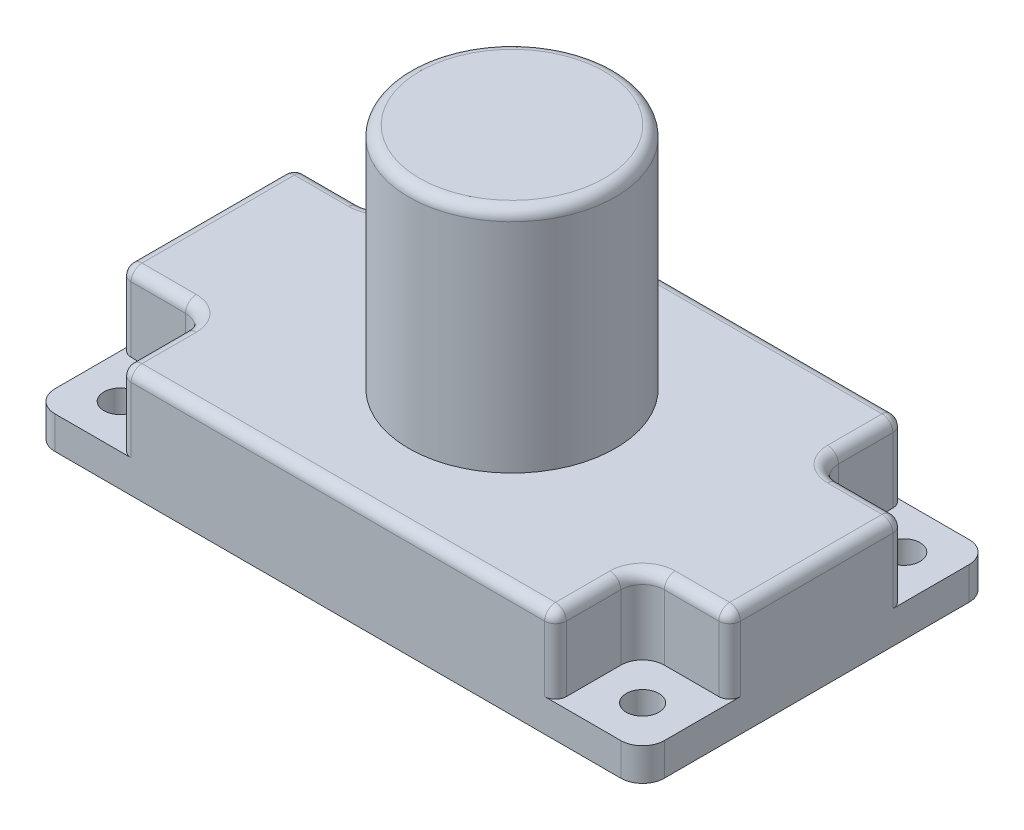
from build123d import *

# Parameters (mm, degrees)
CROQUIS1_W              = 56
CROQUIS1_H              = 32
SALIENTE_EXTRUIR1_DEPTH = 10
CROQUIS2_R              = 9.5
SALIENTE_EXTRUIR2_DEPTH = 21
CROQUIS3_W              = 8
CROQUIS3_H              = 8
CORTAR_EXTRUIR1_DEPTH   = 7
CROQUIS4_R              = 1.5
CORTAR_EXTRUIR2_DEPTH   = 71.313583325
REDONDEO1_R             = 2
REDONDEO2_R             = 1
REDONDEO3_R             = 1
REDONDEO4_R             = 1


with BuildPart() as part:
    # Croquis1 → Saliente-Extruir1 (new body)
    with BuildSketch(Plane(origin=(0, 0, 0), x_dir=(1, 0, 0), z_dir=(0, 1, 0))):
        with Locations((28, -16)):
            Rectangle(CROQUIS1_W, CROQUIS1_H)
    extrude(amount=SALIENTE_EXTRUIR1_DEPTH)

    # Croquis2 → Saliente-Extruir2 (add)
    with BuildSketch(Plane(origin=(0, 10, 0), x_dir=(1, 0, 0), z_dir=(0, 1, 0))):
        with Locations((28, -16)):
            Circle(CROQUIS2_R)
    extrude(amount=SALIENTE_EXTRUIR2_DEPTH)

    # Croquis3 → Cortar-Extruir1 (cut)
    with BuildSketch(Plane(origin=(0, 10, 0), x_dir=(1, 0, 0), z_dir=(0, 1, 0))):
        with Locations((52, -28)):
            Rectangle(CROQUIS3_W, CROQUIS3_H)
        with Locations((52, -4)):
            Rectangle(CROQUIS3_W, CROQUIS3_H)
        with Locations((4, -4)):
            Rectangle(CROQUIS3_W, CROQUIS3_H)
        with Locations((4, -28)):
            Rectangle(CROQUIS3_W, CROQUIS3_H)
    extrude(amount=-CORTAR_EXTRUIR1_DEPTH, mode=Mode.SUBTRACT)

    # Croquis4 → Cortar-Extruir2 (cut, through all)
    with BuildSketch(Plane(origin=(0, 3, 0), x_dir=(1, 0, 0), z_dir=(0, 1, 0))):
        with Locations((4, -4)):
            Circle(CROQUIS4_R)
        with Locations((4, -28)):
            Circle(CROQUIS4_R)
        with Locations((52, -28)):
            Circle(CROQUIS4_R)
        with Locations((52, -4)):
            Circle(CROQUIS4_R)
    extrude(amount=-CORTAR_EXTRUIR2_DEPTH, mode=Mode.SUBTRACT)

    # Redondeo1
    redondeo1_edges = [part.edges().sort_by_distance(p)[0] for p in [
        (48, 6.5, 8),
        (56, 1.5, 0),
        (56, 1.5, 32),
        (48, 6.5, 24),
        (8, 6.5, 8),
        (0, 1.5, 0),
        (0, 1.5, 32),
        (8, 6.5, 24),
    ]]
    fillet(redondeo1_edges, radius=REDONDEO1_R)

    # Redondeo2
    redondeo2_edges = [part.edges().sort_by_distance(p)[0] for p in [
        (0, 10, 16),
        (28, 10, 0),
        (56, 10, 16),
        (28, 10, 32),
    ]]
    fillet(redondeo2_edges, radius=REDONDEO2_R)

    # Redondeo3
    redondeo3_edges = [part.edges().sort_by_distance(p)[0] for p in [
        (8, 6, 0),
        (8, 9.707106781, 0.292893219),
        (8, 10, 3.5),
        (0, 6, 8),
        (0.292893219, 9.707106781, 8),
        (3.5, 10, 8),
        (48, 6, 0),
        (56, 6, 8),
        (55.707106781, 9.707106781, 8),
        (52.5, 10, 8),
        (48.585786438, 10, 7.414213562),
        (48, 10, 3.5),
        (56, 6, 24),
        (55.707106781, 9.707106781, 24),
        (52.5, 10, 24),
        (48.585786438, 10, 24.585786438),
        (48, 10, 28.5),
        (48, 6, 32),
        (8, 6, 32),
        (8, 9.707106781, 31.707106781),
        (8, 10, 28.5),
        (7.414213562, 10, 24.585786438),
        (3.5, 10, 24),
        (0, 6, 24),
        (7.414213562, 10, 7.414213562),
        (48, 9.707106781, 0.292893219),
        (48, 9.707106781, 31.707106781),
        (0.292893219, 9.707106781, 24),
    ]]
    fillet(redondeo3_edges, radius=REDONDEO3_R)

    # Redondeo4
    redondeo4_edges = [part.edges().sort_by_distance(p)[0] for p in [
        (18.5, 31, 16),
    ]]
    fillet(redondeo4_edges, radius=REDONDEO4_R)


solid = part.part
